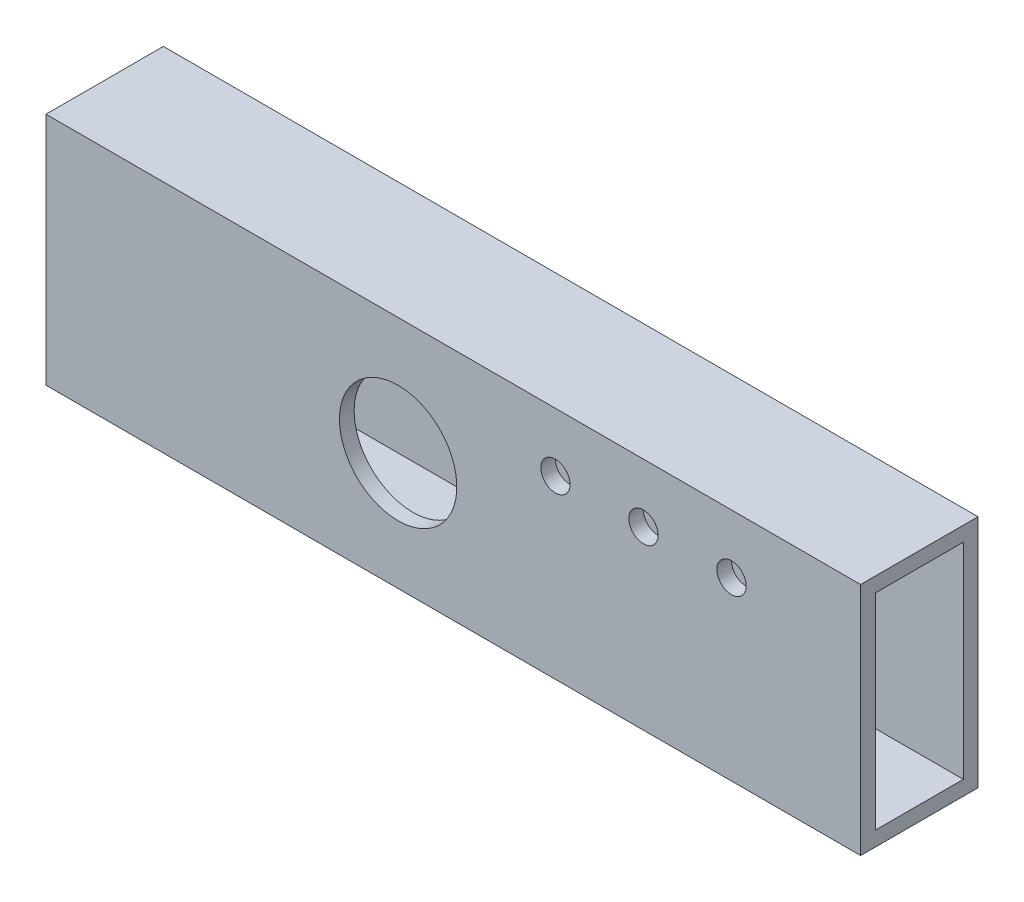
from build123d import *

# Parameters (mm, degrees)
SKETCH1_W           = 176.276
SKETCH1_H           = 25.4
BOSS_EXTRUDE1_DEPTH = 50.8
SKETCH2_OUTSIDE_W   = 64.44
SKETCH2_OUTSIDE_H   = 89.84
SKETCH2_OUTSIDE_W_2 = 25.4
SKETCH2_OUTSIDE_H_2 = 50.8
SKETCH2_OUTSIDE_W_3 = 19.05
SKETCH2_OUTSIDE_H_3 = 44.45
CUT_EXTRUDE1_DEPTH  = 186.199968078
SKETCH3_R           = 12.7
CUT_EXTRUDE2_DEPTH  = 186.199968078
SKETCH4_R           = 3.175
CUT_EXTRUDE3_DEPTH  = 186.199968078


with BuildPart() as part:
    # Sketch1 → Boss-Extrude1 (new body)
    with BuildSketch(Plane(origin=(0, 0, 0), x_dir=(1, 0, 0), z_dir=(0, 1, 0))):
        with Locations((88.138, 12.7)):
            Rectangle(SKETCH1_W, SKETCH1_H)
    extrude(amount=BOSS_EXTRUDE1_DEPTH)

    # Sketch2 outside → Cut-Extrude1 (cut, through all)
    # profile 1 of 2: a face of its own
    with BuildSketch(Plane(origin=(176.276, 0, 0), x_dir=(0, 0, -1), z_dir=(1, 0, 0))):
        with Locations((12.7, 25.4)):
            Rectangle(SKETCH2_OUTSIDE_W, SKETCH2_OUTSIDE_H)
        with Locations((12.7, 25.4)):
            Rectangle(SKETCH2_OUTSIDE_W_2, SKETCH2_OUTSIDE_H_2, mode=Mode.SUBTRACT)
    # profile 2 of 2: a face of its own
    with BuildSketch(Plane(origin=(176.276, 0, 0), x_dir=(0, 0, -1), z_dir=(1, 0, 0))):
        with Locations((12.7, 25.4)):
            Rectangle(SKETCH2_OUTSIDE_W_3, SKETCH2_OUTSIDE_H_3)
    extrude(amount=-CUT_EXTRUDE1_DEPTH, mode=Mode.SUBTRACT)

    # Sketch3 → Cut-Extrude2 (cut, through all)
    with BuildSketch(Plane(origin=(0, 0, -25.4), x_dir=(-1, 0, 0), z_dir=(0, 0, -1))):
        with Locations((-76.2, 25.4)):
            Circle(SKETCH3_R)
    extrude(amount=-CUT_EXTRUDE2_DEPTH, mode=Mode.SUBTRACT)

    # Sketch4 → Cut-Extrude3 (cut, through all)
    with BuildSketch(Plane.XY):
        with Locations((148.336, 38.1)):
            Circle(SKETCH4_R)
        with Locations((129.286, 38.1)):
            Circle(SKETCH4_R)
        with Locations((110.236, 38.1)):
            Circle(SKETCH4_R)
    extrude(amount=-CUT_EXTRUDE3_DEPTH, mode=Mode.SUBTRACT)


solid = part.part
